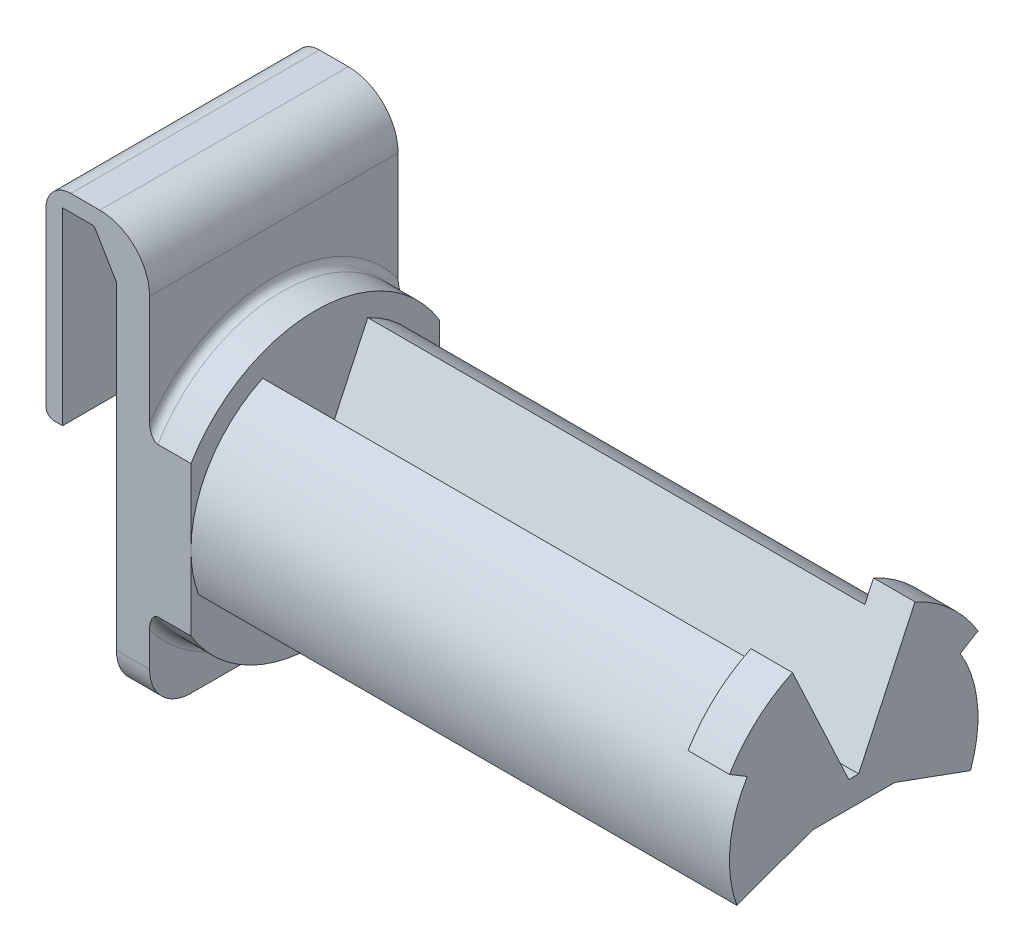
from build123d import *

# Parameters (mm, degrees)
BOSS_EXTRUDE1_DEPTH = 30
BOSS_EXTRUDE3_DEPTH = 5
BOSS_EXTRUDE4_DEPTH = 60
BOSS_EXTRUDE5_DEPTH = 5
RIB2_REACH          = 93.092
SKETCH12_WALL_W     = 244.715003534
SKETCH12_WALL_H     = 1.5
RIB4_REACH          = 88.249
SKETCH15_WALL_W     = 235.02855303
SKETCH15_WALL_H     = 1.5
FILLET2_R           = 6
FILLET3_R           = 3
FILLET4_R           = 5
FILLET6_R           = 1
CUT_EXTRUDE4_DEPTH  = 88.321245983
SKETCH17_R          = 12.5
CUT_EXTRUDE5_DEPTH  = 5
FILLET7_R           = 1
FILLET8_R           = 1


with BuildPart() as part:
    # Sketch1 → Boss-Extrude1 (new body)
    with BuildSketch(Plane.XY):
        Polygon((0, 0), (0, 50), (-12.5, 50), (-12.5, 25.213498553), (-10.5, 25.213498553), (-10.5, 48), (-6.7, 48), (-4, 43.5), (-4, 0), align=None)
    extrude(amount=BOSS_EXTRUDE1_DEPTH)

    # Sketch2 → Boss-Extrude3 (add)
    with BuildSketch(Plane(origin=(0, 0, 0), x_dir=(0, 0, -1), z_dir=(1, 0, 0))):
        with BuildLine():
            Line((-30, 20), (-30, 29.013878189))
            ThreePointArc((-30, 29.013878189), (-15, 37.5), (0, 29.013878189))
            Line((0, 29.013878189), (0, 20))
            Line((0, 20), (0, 10.986121811))
            ThreePointArc((0, 10.986121811), (-15, 2.5), (-30, 10.986121811))
            Line((-30, 10.986121811), (-30, 20))
        make_face()
    extrude(amount=BOSS_EXTRUDE3_DEPTH)

    # Sketch8 → Boss-Extrude4 (add)
    with BuildSketch(Plane(origin=(5, 0, 0), x_dir=(0, 0, -1), z_dir=(1, 0, 0))):
        with BuildLine():
            Line((-15.593853911, 21.273523821), (-14.406146089, 21.273523821))
            Line((-14.406146089, 21.273523821), (-8.660726074, 33.594616806))
            ThreePointArc((-8.660726074, 33.594616806), (-1.141807012, 25.740251485), (-0.904610688, 14.86969785))
            Line((-0.904610688, 14.86969785), (-10.032290508, 18.191901612))
            Line((-10.032290508, 18.191901612), (-19.967709492, 18.191901612))
            Line((-19.967709492, 18.191901612), (-29.095389312, 14.86969785))
            ThreePointArc((-29.095389312, 14.86969785), (-28.858192988, 25.740251485), (-21.339273926, 33.594616806))
            Line((-21.339273926, 33.594616806), (-15.593853911, 21.273523821))
        make_face()
    extrude(amount=BOSS_EXTRUDE4_DEPTH)

    # Sketch9 → Boss-Extrude5 (add)
    with BuildSketch(Plane(origin=(65, 0, 0), x_dir=(0, 0, -1), z_dir=(1, 0, 0))):
        with BuildLine():
            Line((-21.339273926, 33.594616806), (-22.39581958, 35.860386273))
            ThreePointArc((-22.39581958, 35.860386273), (-26.709477013, 33.005312303), (-30, 29.013878189))
            Line((-30, 29.013878189), (-27.857142857, 27.726181305))
            ThreePointArc((-27.857142857, 27.726181305), (-29.930908857, 21.438040583), (-29.095389312, 14.86969785))
            Line((-29.095389312, 14.86969785), (-19.967709492, 18.191901612))
            Line((-19.967709492, 18.191901612), (-10.032290508, 18.191901612))
            Line((-10.032290508, 18.191901612), (-0.904610688, 14.86969785))
            ThreePointArc((-0.904610688, 14.86969785), (-0.069091143, 21.438040583), (-2.142857143, 27.726181305))
            Line((-2.142857143, 27.726181305), (0, 29.013878189))
            ThreePointArc((0, 29.013878189), (-3.290522987, 33.005312303), (-7.60418042, 35.860386273))
            Line((-7.60418042, 35.860386273), (-8.660726074, 33.594616806))
            Line((-8.660726074, 33.594616806), (-14.406146089, 21.273523821))
            Line((-14.406146089, 21.273523821), (-15.593853911, 21.273523821))
            Line((-15.593853911, 21.273523821), (-21.339273926, 33.594616806))
        make_face()
    extrude(amount=BOSS_EXTRUDE5_DEPTH)

    # Sketch12 wall → Rib2 (add, up to next)
    with BuildSketch(Plane(origin=(35, 12.772029248, 23.163468829), x_dir=(0.991227900683, 0.1241932725, 0.045202654495), z_dir=(-0.132163720089, 0.931449543789, 0.33901990866)), mode=Mode.PRIVATE) as rib2_sk1:
        Rectangle(SKETCH12_WALL_W, SKETCH12_WALL_H)
    rib2_tool1 = extrude(rib2_sk1.sketch, amount=RIB2_REACH, mode=Mode.PRIVATE) - part.part
    add(rib2_tool1.solids().sort_by_distance((35, 12.772029248, 23.163468829))[0])

    # Sketch15 wall → Rib4 (add, up to next)
    with BuildSketch(Plane(origin=(35, 12.772029248, 6.836531171), x_dir=(0.991227900683, 0.1241932725, -0.045202654495), z_dir=(-0.132163720089, 0.931449543789, -0.33901990866)), mode=Mode.PRIVATE) as rib4_sk1:
        Rectangle(SKETCH15_WALL_W, SKETCH15_WALL_H)
    rib4_tool1 = extrude(rib4_sk1.sketch, amount=RIB4_REACH, mode=Mode.PRIVATE) - part.part
    add(rib4_tool1.solids().sort_by_distance((35, 12.772029248, 6.836531171))[0])

    # Fillet2
    fillet2_edges = [part.edges().sort_by_distance(p)[0] for p in [
        (0, 50, 15),
    ]]
    fillet(fillet2_edges, radius=FILLET2_R)

    # Fillet3
    fillet3_edges = [part.edges().sort_by_distance(p)[0] for p in [
        (-12.5, 50, 15),
    ]]
    fillet(fillet3_edges, radius=FILLET3_R)

    # Fillet4
    fillet4_edges = [part.edges().sort_by_distance(p)[0] for p in [
        (-2, 0, 0),
        (-2, 0, 30),
    ]]
    fillet(fillet4_edges, radius=FILLET4_R)

    # Fillet6
    # the kernel refuses this fillet: 1 mm, written as the material it adds along each edge
    with BuildSketch(Plane(origin=(67.5, 16.274284624, 25.236318868), x_dir=(-8.283054797608712e-12, -0.34202014332566627, 0.9396926207859093), z_dir=(-1.0, 2.8329715890524774e-12, -7.783525470878232e-12))) as fillet6_piece_1_section:
        with BuildLine():
            CenterArc((FILLET6_R, -FILLET6_R), FILLET6_R, 90, 90)
            Line((0, -FILLET6_R), (0, 0))
            Line((0, 0), (FILLET6_R, 0))
        make_face()
    fillet6_piece_1 = extrude(amount=65, mode=Mode.PRIVATE)
    fillet6_piece_1 = split(fillet6_piece_1, bisect_by=Plane(origin=(34.683018445, 12.397159057, 24.069843938), z_dir=(-0.13216372008897792, 0.9314495437888441, 0.33901990865994336)), keep=Keep.TOP, mode=Mode.PRIVATE)
    add(fillet6_piece_1)
    with BuildSketch(Plane(origin=(2.5, 16.787314839, 23.826779936), x_dir=(8.283054797608713e-12, 0.3420201433256657, -0.9396926207859096), z_dir=(1.0, -2.8329715890524774e-12, 7.783525470878232e-12))) as fillet6_piece_2_section:
        with BuildLine():
            CenterArc((FILLET6_R, -FILLET6_R), FILLET6_R, 90, 90)
            Line((0, -FILLET6_R), (0, 0))
            Line((0, 0), (FILLET6_R, 0))
        make_face()
    fillet6_piece_2 = extrude(amount=65, mode=Mode.PRIVATE)
    fillet6_piece_2 = split(fillet6_piece_2, bisect_by=Plane(origin=(4.790210247, 9.320920511, 20.868309995), z_dir=(-0.13216372008897792, 0.9314495437888441, 0.33901990865994336)), keep=Keep.TOP, mode=Mode.PRIVATE)
    add(fillet6_piece_2)
    with BuildSketch(Plane(origin=(67.5, 16.787314839, 6.173220063), x_dir=(8.283047858714808e-12, 0.3420201433256657, 0.9396926207859096), z_dir=(-1.0, 2.8329692158109876e-12, 7.783518950450833e-12))) as fillet6_piece_3_section:
        with BuildLine():
            CenterArc((FILLET6_R, -FILLET6_R), FILLET6_R, 90, 90)
            Line((0, -FILLET6_R), (0, 0))
            Line((0, 0), (FILLET6_R, 0))
        make_face()
    fillet6_piece_3 = extrude(amount=65, mode=Mode.PRIVATE)
    fillet6_piece_3 = split(fillet6_piece_3, bisect_by=Plane(origin=(34.683018444, 13.067468711, 7.7718167), z_dir=(-0.13216372008897792, 0.9314495437888441, -0.33901990865994336)), keep=Keep.TOP, mode=Mode.PRIVATE)
    add(fillet6_piece_3)
    with BuildSketch(Plane(origin=(2.5, 16.274284624, 4.763681132), x_dir=(-8.283047858714808e-12, -0.342020143325666, -0.9396926207859094), z_dir=(1.0, -2.8329692158109876e-12, -7.783518950450833e-12))) as fillet6_piece_4_section:
        with BuildLine():
            CenterArc((FILLET6_R, -FILLET6_R), FILLET6_R, 90, 90)
            Line((0, -FILLET6_R), (0, 0))
            Line((0, 0), (FILLET6_R, 0))
        make_face()
    fillet6_piece_4 = extrude(amount=65, mode=Mode.PRIVATE)
    fillet6_piece_4 = split(fillet6_piece_4, bisect_by=Plane(origin=(4.790210247, 8.653026917, 7.296667437), z_dir=(-0.13216372008897792, 0.9314495437888441, -0.33901990865994336)), keep=Keep.TOP, mode=Mode.PRIVATE)
    add(fillet6_piece_4)

    # Sketch16 → Cut-Extrude4 (cut, through all)
    with BuildSketch(Plane(origin=(5, 0, 0), x_dir=(0, 0, -1), z_dir=(1, 0, 0))):
        Polygon((-19.967709492, 16.824178281), (-10.106442475, 16.824178281), (-8.435471613, 16.167725442), (-12.864533528, 4.893749658), (-16.690177608, 4.893749658), (-21.504850857, 16.167725442), align=None)
    extrude(amount=-CUT_EXTRUDE4_DEPTH, mode=Mode.SUBTRACT)

    # Sketch17 → Cut-Extrude5 (cut)
    with BuildSketch(Plane.ZY.offset(4)):
        with Locations((15, 20)):
            Circle(SKETCH17_R)
    extrude(amount=-CUT_EXTRUDE5_DEPTH, mode=Mode.SUBTRACT)

    # Fillet7
    fillet7_edges = [part.edges().sort_by_distance(p)[0] for p in [
        (-12.5, 25.213498553, 15),
    ]]
    fillet(fillet7_edges, radius=FILLET7_R)

    # Fillet8
    fillet8_edges = [part.edges().sort_by_distance(p)[0] for p in [
        (0, 37.5, 15),
        (0, 2.5, 15),
    ]]
    fillet(fillet8_edges, radius=FILLET8_R)


solid = part.part
